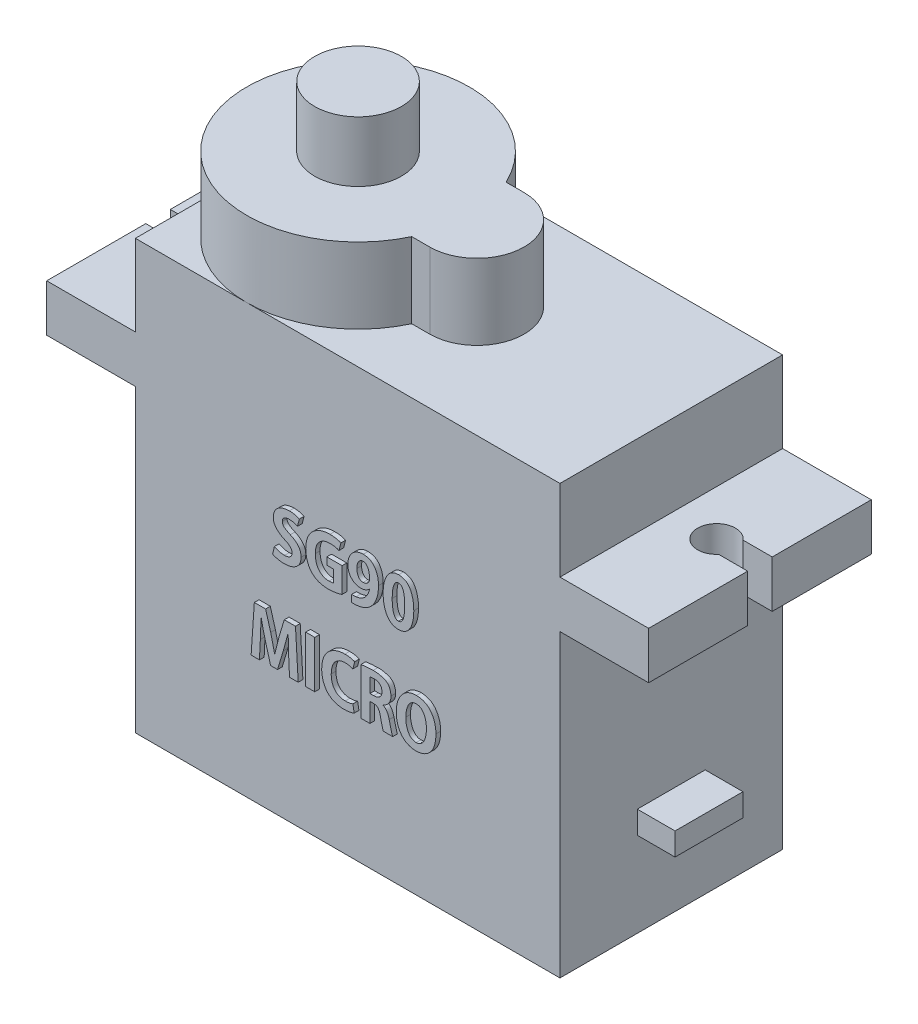
from build123d import *

# Parameters (mm, degrees)
BOSS_EXTRUDE1_DEPTH = 5.9
BOSS_EXTRUDE2_DEPTH = 4
SKETCH3_R           = 2.3
BOSS_EXTRUDE3_DEPTH = 3.2
CUT_EXTRUDE1_DEPTH  = 26.055388642
SKETCH5_W           = 3.6
SKETCH5_H           = 1.2
BOSS_EXTRUDE4_DEPTH = 2
WRAP1_OUTLINE_W     = 0.47888441
WRAP1_OUTLINE_H     = 2.5
WRAP1_DEPTH         = 0.25


# Read off the part's stored shape, not the designer's step: Wrap1
with BuildPart() as part:
    # Sketch1 → Boss-Extrude1 (new, symmetric)
    with BuildSketch(Plane.XY):
        Polygon((-11.25, -15.9), (-11.25, 0), (-15.95, 0), (-15.95, 2.5), (-11.25, 2.5), (-11.25, 6.8), (11.25, 6.8), (11.25, 2.5), (15.95, 2.5), (15.95, 0), (11.25, 0), (11.25, -15.9), align=None)
    extrude(amount=BOSS_EXTRUDE1_DEPTH, both=True)

    # Sketch2 → Boss-Extrude2 (add)
    with BuildSketch(Plane(origin=(0, 6.8, 0), x_dir=(1, 0, 0), z_dir=(0, 1, 0))):
        with BuildLine():
            Line((-0.005844314, 2.5), (0.95, 2.5))
            ThreePointArc((0.95, 2.5), (3.45, 0), (0.95, -2.5))
            Line((0.95, -2.5), (-0.005844314, -2.5))
            ThreePointArc((-0.005844314, -2.5), (-11.25, 0), (-0.005844314, 2.5))
        make_face()
    extrude(amount=BOSS_EXTRUDE2_DEPTH)

    # Sketch3 → Boss-Extrude3 (add)
    with BuildSketch(Plane(origin=(0, 10.8, 0), x_dir=(1, 0, 0), z_dir=(0, 1, 0))):
        with Locations(Location((-5.35, 0, 0), (0, 0, 270))):
            Circle(SKETCH3_R)
    extrude(amount=BOSS_EXTRUDE3_DEPTH)

    # Sketch4 → Cut-Extrude1 (cut, symmetric)
    with BuildSketch(Plane(origin=(0, 2.5, 0), x_dir=(1, 0, 0), z_dir=(0, 1, 0))):
        with BuildLine():
            Line((14.409934208, 0.65), (15.95, 0.65))
            Line((15.95, 0.65), (15.95, -0.65))
            Line((15.95, -0.65), (14.409934208, -0.65))
            ThreePointArc((14.409934208, -0.65), (12.65, 0), (14.409934208, 0.65))
        make_face()
    cut_extrude1 = extrude(amount=CUT_EXTRUDE1_DEPTH, both=True, mode=Mode.SUBTRACT)

    # Mirror1: Cut-Extrude1 across plane
    add(cut_extrude1.mirror(Plane(origin=(0, 0, 0), x_dir=(0, 0, 1), z_dir=(1, 0, 0))), mode=Mode.SUBTRACT)

    # Sketch5 → Boss-Extrude4 (add)
    with BuildSketch(Plane(origin=(11.25, 0, 0), x_dir=(0, 0, -1), z_dir=(1, 0, 0))):
        with Locations((0, -10.8)):
            Rectangle(SKETCH5_W, SKETCH5_H)
    extrude(amount=BOSS_EXTRUDE4_DEPTH)

    # Wrap1 outline → Wrap1 (add)
    # profile 1 of 9: a face of its own
    with BuildSketch(Plane.XY.offset(5.9)):
        with BuildLine():
            add(Edge.make_bspline(
                [(-3.726019761, -3.8052491), (-3.709521827, -3.814377835), (-3.674316811, -3.833857685), (-3.61426598, -3.856927943), (-3.54587038, -3.879911353), (-3.468881391, -3.899388091), (-3.386271723, -3.916903141), (-3.299531612, -3.92951219), (-3.209995099, -3.937702129), (-3.149213892, -3.939186137), (-3.118401781, -3.939938433)],
                knots=[0, 0, 0, 0, 0.089949334, 0.191943291, 0.306549137, 0.434490538, 0.570906174, 0.709705073, 0.85283939, 1, 1, 1, 1], degree=3))
            add(Edge.make_bspline(
                [(-3.118401781, -3.939938433), (-3.083331252, -3.939056892), (-3.015064198, -3.937340917), (-2.9160755, -3.926011514), (-2.823098072, -3.910108536), (-2.736688138, -3.886682939), (-2.656045159, -3.858410103), (-2.582077756, -3.822730493), (-2.514242094, -3.781148453), (-2.452806043, -3.733642075), (-2.398773665, -3.680429819), (-2.350420754, -3.624116348), (-2.311001541, -3.562473888), (-2.277346792, -3.497737271), (-2.252223693, -3.428191465), (-2.232923108, -3.354941283), (-2.222386949, -3.277216948), (-2.220509062, -3.224154578), (-2.219551691, -3.1971027)],
                knots=[0, 0, 0, 0, 0.08005175, 0.155825911, 0.227240158, 0.295191695, 0.359974716, 0.422060291, 0.482286178, 0.541334182, 0.598912813, 0.655171416, 0.710386691, 0.765569336, 0.821404422, 0.878821951, 0.938221873, 1, 1, 1, 1], degree=3))
            add(Edge.make_bspline(
                [(-2.219551691, -3.1971027), (-2.2198883, -3.17682292), (-2.220552682, -3.136795695), (-2.226582591, -3.077777844), (-2.237815899, -3.021035733), (-2.251946905, -2.96587868), (-2.272178416, -2.913339106), (-2.295619867, -2.862333731), (-2.324201416, -2.813799655), (-2.356759058, -2.766817933), (-2.394368351, -2.721939278), (-2.436491879, -2.678369519), (-2.483626257, -2.636487208), (-2.535940273, -2.596525258), (-2.592396871, -2.557142146), (-2.654269222, -2.520119661), (-2.720989153, -2.484768454), (-2.767477178, -2.462728575), (-2.791290107, -2.451438913)],
                knots=[0, 0, 0, 0, 0.060725293, 0.119856575, 0.177345818, 0.233840644, 0.2901215, 0.345691803, 0.401777612, 0.458555828, 0.516690316, 0.576917763, 0.639904969, 0.705312986, 0.773964301, 0.845941959, 0.92108563, 1, 1, 1, 1], degree=3))
            add(Edge.make_bspline(
                [(-2.791290107, -2.451438913), (-2.809391954, -2.443184403), (-2.844500743, -2.427174666), (-2.894851055, -2.402776272), (-2.941189, -2.378671089), (-2.983623622, -2.355097419), (-3.02251629, -2.332169992), (-3.057139005, -2.308942111), (-3.08844803, -2.287063875), (-3.115741061, -2.265081354), (-3.139746976, -2.242885793), (-3.160173626, -2.219188405), (-3.17733844, -2.193849556), (-3.191414929, -2.167353611), (-3.201992248, -2.139269725), (-3.209356707, -2.110017063), (-3.214505068, -2.079258393), (-3.214538596, -2.058203869), (-3.214555645, -2.047498416)],
                knots=[0, 0, 0, 0, 0.095893322, 0.185986453, 0.269650008, 0.34761872, 0.419959612, 0.487171771, 0.548531692, 0.604000941, 0.655968434, 0.705909997, 0.754430356, 0.803210058, 0.850187023, 0.898677824, 0.948481394, 1, 1, 1, 1], degree=3))
            add(Edge.make_bspline(
                [(-3.214555645, -2.047498416), (-3.21362287, -2.029620264), (-3.211775517, -1.994212718), (-3.194848543, -1.942945484), (-3.166832531, -1.895492966), (-3.134686379, -1.860173456), (-3.103861531, -1.834556515), (-3.076778561, -1.817782034), (-3.046928401, -1.802850028), (-3.013640763, -1.791529479), (-2.977728374, -1.781286571), (-2.93855871, -1.774430257), (-2.896319195, -1.770359672), (-2.867184619, -1.769110651), (-2.852093285, -1.768463674)],
                knots=[0, 0, 0, 0, 0.104400616, 0.20676463, 0.312273029, 0.424913538, 0.484372413, 0.546365541, 0.610930973, 0.679281638, 0.751786484, 0.829345722, 0.911603293, 1, 1, 1, 1], degree=3))
            add(Edge.make_bspline(
                [(-2.852093285, -1.768463674), (-2.827567426, -1.76927556), (-2.780146479, -1.770845349), (-2.711605908, -1.777807847), (-2.64827358, -1.789040444), (-2.590251912, -1.804147773), (-2.537915046, -1.821917946), (-2.490697259, -1.838979729), (-2.449251904, -1.856867916), (-2.424197246, -1.870123118), (-2.412330761, -1.8764011)],
                knots=[0, 0, 0, 0, 0.160970687, 0.311238126, 0.451566846, 0.582579129, 0.704168556, 0.814080921, 0.911944276, 1, 1, 1, 1], degree=3))
            Line((-2.412330761, -1.8764011), (-2.312280497, -1.490122137))
            add(Edge.make_bspline(
                [(-2.312280497, -1.490122137), (-2.327820027, -1.483011715), (-2.360232449, -1.468180767), (-2.412335172, -1.447404079), (-2.47084954, -1.430429986), (-2.534369285, -1.412818942), (-2.603827242, -1.3990034), (-2.678649587, -1.387860484), (-2.758999522, -1.382206325), (-2.814222346, -1.380801219), (-2.842666436, -1.380077479)],
                knots=[0, 0, 0, 0, 0.093885412, 0.195826607, 0.307768122, 0.428363098, 0.557859077, 0.696525779, 0.843686948, 1, 1, 1, 1], degree=3))
            add(Edge.make_bspline(
                [(-2.842666436, -1.380077479), (-2.87537269, -1.381222601), (-2.939056057, -1.383452303), (-3.031562332, -1.393778657), (-3.118435785, -1.410190214), (-3.199613507, -1.432821817), (-3.275515029, -1.460953831), (-3.345674444, -1.49548332), (-3.410243625, -1.536130905), (-3.468566327, -1.582948719), (-3.521012043, -1.634137302), (-3.566372628, -1.689674146), (-3.605501482, -1.748346349), (-3.63726621, -1.811006766), (-3.661717401, -1.87736671), (-3.67961997, -1.947159516), (-3.69132146, -2.020560717), (-3.693036346, -2.070863611), (-3.693910937, -2.096518033)],
                knots=[0, 0, 0, 0, 0.078559742, 0.152966122, 0.223255178, 0.290622459, 0.355087877, 0.417344151, 0.478048272, 0.537908362, 0.596597943, 0.653693265, 0.709776301, 0.765621559, 0.821962845, 0.87924233, 0.938413718, 1, 1, 1, 1], degree=3))
            add(Edge.make_bspline(
                [(-3.693910937, -2.096518033), (-3.693160587, -2.116656199), (-3.691677632, -2.156456319), (-3.683391889, -2.21509946), (-3.670900089, -2.271822953), (-3.652853968, -2.326455291), (-3.629434769, -2.378723016), (-3.602299043, -2.429538439), (-3.569391865, -2.477852176), (-3.531527015, -2.523905439), (-3.489650537, -2.568024051), (-3.443944149, -2.610310995), (-3.394533337, -2.65078723), (-3.340968489, -2.689322177), (-3.284083568, -2.726921303), (-3.222521857, -2.761242659), (-3.157925611, -2.795272798), (-3.112711593, -2.815412466), (-3.08964989, -2.825684834)],
                knots=[0, 0, 0, 0, 0.060045621, 0.11867133, 0.176285329, 0.233016685, 0.289850435, 0.346859566, 0.404542072, 0.463798733, 0.524433407, 0.585751735, 0.649325732, 0.714723398, 0.782410973, 0.852478072, 0.924755486, 1, 1, 1, 1], degree=3))
            add(Edge.make_bspline(
                [(-3.08964989, -2.825684834), (-3.057683929, -2.840147391), (-2.997510603, -2.86737198), (-2.915835953, -2.91284835), (-2.847317346, -2.958444342), (-2.792281649, -3.006228843), (-2.74875856, -3.056446008), (-2.719375649, -3.112270136), (-2.700709895, -3.172660131), (-2.699205161, -3.214716502), (-2.69843564, -3.236224125)],
                knots=[0, 0, 0, 0, 0.174208187, 0.327932775, 0.463869018, 0.582215029, 0.689132344, 0.791780352, 0.893516498, 1, 1, 1, 1], degree=3))
            add(Edge.make_bspline(
                [(-2.69843564, -3.236224125), (-2.698657246, -3.247867885), (-2.699090433, -3.270628705), (-2.703938097, -3.303812778), (-2.711845731, -3.33516713), (-2.723455067, -3.364572273), (-2.73744128, -3.39259303), (-2.755078487, -3.418677981), (-2.77598356, -3.442854611), (-2.800037578, -3.464967786), (-2.827088396, -3.484833622), (-2.857071922, -3.50241196), (-2.890064701, -3.517439154), (-2.92607307, -3.529694159), (-2.965085788, -3.538980429), (-3.00695378, -3.546084058), (-3.052020564, -3.550220199), (-3.083043011, -3.551098364), (-3.09907674, -3.551552238)],
                knots=[0, 0, 0, 0, 0.060610406, 0.118479126, 0.174255688, 0.228664596, 0.282832933, 0.337081579, 0.392205902, 0.448964468, 0.506908369, 0.566701069, 0.629690314, 0.695426735, 0.764501725, 0.838365429, 0.916460334, 1, 1, 1, 1], degree=3))
            add(Edge.make_bspline(
                [(-3.09907674, -3.551552238), (-3.124230445, -3.550739283), (-3.174170355, -3.54912525), (-3.248394131, -3.541657639), (-3.321108807, -3.528794524), (-3.391766463, -3.511487155), (-3.459012333, -3.490338973), (-3.521953962, -3.466948511), (-3.579691156, -3.440742422), (-3.615333246, -3.420464947), (-3.632636415, -3.410620839)],
                knots=[0, 0, 0, 0, 0.135306303, 0.268635751, 0.400728151, 0.532075447, 0.659536786, 0.779580719, 0.89299303, 1, 1, 1, 1], degree=3))
            Line((-3.632636415, -3.410620839), (-3.726019761, -3.8052491))
        make_face()
    # profile 2 of 9: a face of its own
    with BuildSketch(Plane.XY.offset(5.9)):
        with BuildLine():
            Line((-0.495853199, -2.881303706), (-0.495853199, -3.514504443))
            add(Edge.make_bspline(
                [(-0.495853199, -3.514504443), (-0.502068146, -3.517454058), (-0.515257719, -3.523713831), (-0.537992221, -3.52978029), (-0.563701639, -3.536057868), (-0.59300964, -3.541043165), (-0.625684203, -3.545471208), (-0.661909103, -3.547850925), (-0.701641105, -3.550474599), (-0.72931898, -3.551182445), (-0.743778417, -3.551552238)],
                knots=[0, 0, 0, 0, 0.081644328, 0.1732684, 0.278857601, 0.396502646, 0.526508958, 0.670805947, 0.828022889, 1, 1, 1, 1], degree=3))
            add(Edge.make_bspline(
                [(-0.743778417, -3.551552238), (-0.769589485, -3.551030636), (-0.820350952, -3.550004825), (-0.894342649, -3.538614929), (-0.964997253, -3.521518222), (-1.031620999, -3.496046276), (-1.095151888, -3.464733116), (-1.154521232, -3.425437905), (-1.210368612, -3.379558808), (-1.262309316, -3.326579227), (-1.3096456, -3.266872873), (-1.350229111, -3.199507234), (-1.385299687, -3.125670252), (-1.413654877, -3.044649049), (-1.437017694, -2.957270549), (-1.452947661, -2.862881907), (-1.464132469, -2.761837598), (-1.466215051, -2.692012638), (-1.467289109, -2.656001545)],
                knots=[0, 0, 0, 0, 0.059604782, 0.117222045, 0.172616742, 0.227313207, 0.281713572, 0.335997474, 0.391463532, 0.448466519, 0.507161829, 0.567132694, 0.629828367, 0.695753162, 0.765245473, 0.838614105, 0.916767838, 1, 1, 1, 1], degree=3))
            add(Edge.make_bspline(
                [(-1.467289109, -2.656001545), (-1.466075829, -2.620302755), (-1.463722929, -2.551072456), (-1.451858383, -2.451006615), (-1.433693555, -2.358095758), (-1.408852088, -2.272709764), (-1.377730472, -2.19430123), (-1.339452936, -2.123557788), (-1.295134787, -2.059412815), (-1.243099197, -2.003836852), (-1.186460324, -1.954872441), (-1.125997918, -1.912063861), (-1.06116952, -1.876576188), (-0.992825463, -1.84735505), (-0.920539653, -1.824512476), (-0.844429774, -1.808705174), (-0.76445639, -1.799016926), (-0.709869857, -1.798136099), (-0.682032554, -1.797686907)],
                knots=[0, 0, 0, 0, 0.081158924, 0.157390671, 0.228756257, 0.296107102, 0.359237718, 0.42011516, 0.478567741, 0.53593354, 0.592640872, 0.648519059, 0.703981474, 0.760297277, 0.817220091, 0.875982743, 0.936755354, 1, 1, 1, 1], degree=3))
            add(Edge.make_bspline(
                [(-0.682032554, -1.797686907), (-0.65578944, -1.798111021), (-0.605302074, -1.798926944), (-0.532739928, -1.803365492), (-0.466576704, -1.811607745), (-0.406186684, -1.821573658), (-0.351212222, -1.835383171), (-0.3001458, -1.849472688), (-0.25336132, -1.866596319), (-0.223981664, -1.879551327), (-0.209747399, -1.885827949)],
                knots=[0, 0, 0, 0, 0.162603636, 0.312822215, 0.450098562, 0.575560869, 0.691717561, 0.801089253, 0.903628951, 1, 1, 1, 1], degree=3))
            Line((-0.209747399, -1.885827949), (-0.110784353, -1.486298003))
            add(Edge.make_bspline(
                [(-0.110784353, -1.486298003), (-0.127039126, -1.478988767), (-0.161292291, -1.463586247), (-0.217128087, -1.443079974), (-0.280740274, -1.426302105), (-0.350901395, -1.410126043), (-0.427507966, -1.397017689), (-0.509649606, -1.387733944), (-0.597114829, -1.382130359), (-0.657200229, -1.381086621), (-0.688160006, -1.380548821)],
                knots=[0, 0, 0, 0, 0.090390589, 0.190477202, 0.301261597, 0.423833096, 0.555634891, 0.695213287, 0.842954714, 1, 1, 1, 1], degree=3))
            add(Edge.make_bspline(
                [(-0.688160006, -1.380548821), (-0.733300555, -1.38166018), (-0.821829572, -1.383839762), (-0.9514777, -1.400215185), (-1.074961559, -1.426538041), (-1.192593924, -1.462896019), (-1.304216778, -1.509460488), (-1.409422251, -1.567103736), (-1.508893246, -1.634209771), (-1.586240216, -1.698417801), (-1.643989765, -1.754886961), (-1.684877385, -1.799592462), (-1.723441356, -1.846403759), (-1.758553525, -1.895897068), (-1.791217562, -1.947538403), (-1.821458011, -2.001249455), (-1.848844099, -2.057439055), (-1.873192823, -2.116103244), (-1.895649499, -2.176785377), (-1.914135195, -2.240091636), (-1.930701172, -2.305320488), (-1.945100392, -2.372692393), (-1.955566099, -2.442635041), (-1.964202523, -2.514760026), (-1.969909052, -2.58930285), (-1.971360609, -2.639809482), (-1.972096894, -2.665428394)],
                knots=[0, 0, 0, 0, 0.066177184, 0.129785772, 0.191283754, 0.251108841, 0.310068885, 0.368317079, 0.426719516, 0.485773106, 0.515423448, 0.545100629, 0.574569622, 0.604296836, 0.634016908, 0.664136115, 0.694634449, 0.725611945, 0.757242206, 0.789459355, 0.822258555, 0.855920241, 0.890425936, 0.925917359, 0.962422427, 1, 1, 1, 1], degree=3))
            add(Edge.make_bspline(
                [(-1.972096894, -2.665428394), (-1.970809702, -2.715433139), (-1.96828891, -2.8133607), (-1.951790232, -2.956758887), (-1.923804798, -3.093065986), (-1.891968094, -3.201709352), (-1.861218632, -3.284325164), (-1.835543188, -3.343082143), (-1.807847456, -3.399159536), (-1.777715438, -3.452564686), (-1.744901327, -3.502955667), (-1.710862307, -3.551340665), (-1.673304682, -3.596234648), (-1.646553211, -3.624281286), (-1.633201658, -3.638279252)],
                knots=[0, 0, 0, 0, 0.142070221, 0.278225407, 0.409455379, 0.536998446, 0.599432275, 0.659805439, 0.71909623, 0.777066659, 0.833900218, 0.889891332, 0.945045199, 1, 1, 1, 1], degree=3))
            add(Edge.make_bspline(
                [(-1.633201658, -3.638279252), (-1.606271863, -3.662857126), (-1.552338194, -3.712080483), (-1.460704453, -3.773701327), (-1.361545703, -3.825818469), (-1.254494831, -3.868152924), (-1.139588685, -3.901242221), (-1.016848138, -3.924499029), (-0.886137219, -3.938449127), (-0.796447337, -3.939433037), (-0.750377212, -3.939938433)],
                knots=[0, 0, 0, 0, 0.114129581, 0.228573108, 0.344861668, 0.464636797, 0.588675599, 0.719038151, 0.855681074, 1, 1, 1, 1], degree=3))
            add(Edge.make_bspline(
                [(-0.750377212, -3.939938433), (-0.714853035, -3.939199383), (-0.644974617, -3.937745622), (-0.542131476, -3.929420343), (-0.442872741, -3.917315868), (-0.348247362, -3.900917594), (-0.260145402, -3.881710252), (-0.180616183, -3.861536543), (-0.110496419, -3.841167158), (-0.067647352, -3.825609055), (-0.047605589, -3.818332076)],
                knots=[0, 0, 0, 0, 0.14873289, 0.292567484, 0.431759076, 0.567261587, 0.694476425, 0.809185708, 0.910750569, 1, 1, 1, 1], degree=3))
            Line((-0.047605589, -3.818332076), (-0.047134707, -2.49857362))
            Line((-0.047134707, -2.49857362), (-0.857590133, -2.49857362))
            Line((-0.857590133, -2.49857362), (-0.857590133, -2.881303706))
            Line((-0.857590133, -2.881303706), (-0.495853199, -2.881303706))
        make_face()
    # profile 3 of 9: a face of its own
    with BuildSketch(Plane.XY.offset(5.9)):
        with BuildLine():
            add(Edge.make_bspline(
                [(0.460291238, -3.939594592), (0.490372136, -3.940177953), (0.549697682, -3.941328458), (0.637355817, -3.937653982), (0.722110345, -3.931190999), (0.803797227, -3.921495187), (0.882249349, -3.907671964), (0.957614584, -3.890789324), (1.030118428, -3.870679499), (1.099256107, -3.846241541), (1.166066979, -3.820103038), (1.228723827, -3.788111746), (1.289336174, -3.754907551), (1.345961585, -3.71644485), (1.400411553, -3.675968489), (1.450817874, -3.630674501), (1.498591418, -3.582586146), (1.558098534, -3.514082937), (1.625118336, -3.422054605), (1.695293341, -3.304217669), (1.754189974, -3.178788619), (1.802549786, -3.046342767), (1.838954163, -2.906569559), (1.865542159, -2.759927179), (1.880585733, -2.60573032), (1.882192364, -2.500490773), (1.883013167, -2.446725488)],
                knots=[0, 0, 0, 0, 0.038244534, 0.075425869, 0.111490945, 0.146302794, 0.179964872, 0.212725223, 0.244472331, 0.27555384, 0.305934172, 0.335593393, 0.364929984, 0.393739526, 0.422544913, 0.451127797, 0.479801977, 0.508684835, 0.566418076, 0.624280766, 0.68281027, 0.742338225, 0.803291989, 0.866219321, 0.931653485, 1, 1, 1, 1], degree=3))
            add(Edge.make_bspline(
                [(1.883013167, -2.446725488), (1.882374709, -2.409468548), (1.881125314, -2.336560595), (1.871519443, -2.229980456), (1.85621979, -2.128658656), (1.834162411, -2.032631404), (1.805252605, -1.942145363), (1.771104541, -1.856711615), (1.72976494, -1.777089905), (1.682449099, -1.703146157), (1.629018997, -1.636010822), (1.568863984, -1.577264962), (1.502663321, -1.526974324), (1.429891108, -1.485677989), (1.350774174, -1.453478078), (1.265623778, -1.430211188), (1.174331524, -1.414746771), (1.111331616, -1.411773741), (1.078902914, -1.410243397)],
                knots=[0, 0, 0, 0, 0.0755691, 0.147880864, 0.216892689, 0.28330391, 0.347511938, 0.409419572, 0.469717947, 0.529216711, 0.587254895, 0.643375511, 0.699342968, 0.755439142, 0.812613274, 0.872154705, 0.934192649, 1, 1, 1, 1], degree=3))
            add(Edge.make_bspline(
                [(1.078902914, -1.410243397), (1.048050188, -1.411663), (0.987605485, -1.414444196), (0.899767262, -1.429071141), (0.816900657, -1.450148116), (0.738869124, -1.478231942), (0.666465793, -1.515062326), (0.598556569, -1.558415731), (0.535972119, -1.609724729), (0.479326319, -1.668090812), (0.428600888, -1.731825974), (0.383592835, -1.799119757), (0.34568358, -1.870384225), (0.314559043, -1.945060893), (0.289940372, -2.023300865), (0.272018243, -2.104983572), (0.26117006, -2.190349848), (0.258953169, -2.248417098), (0.257824331, -2.277984884)],
                knots=[0, 0, 0, 0, 0.069387197, 0.135938996, 0.199767061, 0.26145376, 0.321957935, 0.382022269, 0.442268103, 0.503468429, 0.564538128, 0.625182378, 0.685233208, 0.745718819, 0.806829369, 0.86939677, 0.933496967, 1, 1, 1, 1], degree=3))
            add(Edge.make_bspline(
                [(0.257824331, -2.277984884), (0.258961652, -2.306611113), (0.261180928, -2.362470028), (0.271694817, -2.443798862), (0.287647098, -2.520416467), (0.308986854, -2.592438118), (0.337361549, -2.65919962), (0.369936518, -2.721912387), (0.40957165, -2.779173345), (0.454168193, -2.831587505), (0.503853434, -2.87784413), (0.556042997, -2.919458696), (0.612325068, -2.9538272), (0.671289778, -2.98297904), (0.733881556, -3.005019448), (0.799429758, -3.020907154), (0.868014196, -3.031812508), (0.914990038, -3.033273925), (0.9389142, -3.034018206)],
                knots=[0, 0, 0, 0, 0.075338445, 0.147009363, 0.21542667, 0.281065864, 0.34424093, 0.40599658, 0.466644053, 0.527031817, 0.586679507, 0.64497139, 0.702322245, 0.759811448, 0.81772551, 0.876469898, 0.937087786, 1, 1, 1, 1], degree=3))
            add(Edge.make_bspline(
                [(0.9389142, -3.034018206), (0.963772393, -3.033230289), (1.01211862, -3.031697884), (1.082079136, -3.021698864), (1.147202656, -3.005756399), (1.207663567, -2.983539574), (1.263000131, -2.955127939), (1.314164418, -2.922354179), (1.360571617, -2.884745515), (1.387773179, -2.856004212), (1.401301163, -2.841710478)],
                knots=[0, 0, 0, 0, 0.144395029, 0.280831146, 0.409667473, 0.53326653, 0.654091248, 0.770297817, 0.885763636, 1, 1, 1, 1], degree=3))
            Line((1.401301163, -2.841710478), (1.410977953, -2.844870406))
            add(Edge.make_bspline(
                [(1.410977953, -2.844870406), (1.406192958, -2.868248238), (1.396749709, -2.914384685), (1.377104085, -2.981421618), (1.354219754, -3.045601568), (1.327039703, -3.106754207), (1.296636234, -3.165192815), (1.261882781, -3.220756976), (1.223373086, -3.273448057), (1.180909173, -3.3230051), (1.134793589, -3.36902349), (1.084254243, -3.410063206), (1.029595032, -3.446153986), (0.970954567, -3.477177017), (0.908586617, -3.50376355), (0.842085053, -3.524832053), (0.771663759, -3.541555061), (0.72295183, -3.548483094), (0.698058198, -3.55202358)],
                knots=[0, 0, 0, 0, 0.06607286, 0.130395621, 0.193307205, 0.25468426, 0.315613782, 0.375630338, 0.436040079, 0.496225233, 0.5562339, 0.616250456, 0.676240183, 0.737372972, 0.799775216, 0.863773261, 0.930382999, 1, 1, 1, 1], degree=3))
            add(Edge.make_bspline(
                [(0.698058198, -3.55202358), (0.68108487, -3.553376514), (0.649960385, -3.555857429), (0.607601015, -3.560079459), (0.573453362, -3.562057411), (0.539276576, -3.565006995), (0.502227179, -3.565426338), (0.474001736, -3.563082141), (0.460030251, -3.561921772)],
                knots=[0, 0, 0, 0, 0.214070516, 0.392547345, 0.535110574, 0.64403833, 0.823800357, 1, 1, 1, 1], degree=3))
            Line((0.460030251, -3.561921772), (0.460291238, -3.939594592))
        make_face()
        with BuildLine():
            add(Edge.make_bspline(
                [(1.062754831, -1.737827334), (1.0766782, -1.738840937), (1.104000503, -1.740829966), (1.143329346, -1.750579476), (1.179987464, -1.764723972), (1.214147457, -1.783841797), (1.245186976, -1.808459696), (1.273312526, -1.83832337), (1.298893062, -1.872915821), (1.321133054, -1.912547152), (1.340811047, -1.955823338), (1.357648294, -2.002245465), (1.372359268, -2.051293481), (1.384102319, -2.103271314), (1.392813018, -2.157932715), (1.399600821, -2.215309537), (1.403204855, -2.275424609), (1.403817359, -2.316473692), (1.404129218, -2.337374035)],
                knots=[0, 0, 0, 0, 0.054666474, 0.107273888, 0.158194256, 0.208408822, 0.260183252, 0.312920419, 0.368871477, 0.428485839, 0.490803097, 0.555134974, 0.622004819, 0.691513952, 0.76394418, 0.839000286, 0.918026199, 1, 1, 1, 1], degree=3))
            add(Edge.make_bspline(
                [(1.404129218, -2.337374035), (1.404203762, -2.348687204), (1.404344599, -2.370061432), (1.403415842, -2.400242844), (1.401646414, -2.426843917), (1.397951366, -2.456161193), (1.392543394, -2.48757058), (1.382688665, -2.509387087), (1.378205382, -2.519312229)],
                knots=[0, 0, 0, 0, 0.183027137, 0.345797344, 0.488514471, 0.614004943, 0.824396484, 1, 1, 1, 1], degree=3))
            add(Edge.make_bspline(
                [(1.378205382, -2.519312229), (1.371138101, -2.531617755), (1.356827697, -2.556534982), (1.329097975, -2.590585969), (1.296004718, -2.621619956), (1.259357172, -2.650902783), (1.217808418, -2.675782588), (1.171571813, -2.693561709), (1.121560737, -2.705199447), (1.0868236, -2.70726236), (1.069004722, -2.708320559)],
                knots=[0, 0, 0, 0, 0.111908031, 0.226600438, 0.345048618, 0.469626333, 0.596426258, 0.725660414, 0.859273848, 1, 1, 1, 1], degree=3))
            add(Edge.make_bspline(
                [(1.069004722, -2.708320559), (1.056882977, -2.707809756), (1.033112917, -2.706808101), (0.998226286, -2.700613917), (0.965425471, -2.690147092), (0.934086577, -2.67639484), (0.90508884, -2.658418756), (0.877668392, -2.636819504), (0.852302319, -2.611264735), (0.828809757, -2.582020743), (0.807484727, -2.54942491), (0.78924, -2.513473522), (0.773534158, -2.474543452), (0.76102252, -2.432338157), (0.750598995, -2.387185066), (0.74319393, -2.338977678), (0.7383784, -2.287821344), (0.737587013, -2.252700753), (0.737179623, -2.234621377)],
                knots=[0, 0, 0, 0, 0.056253621, 0.110310186, 0.163803388, 0.21569279, 0.268706938, 0.321650863, 0.377325171, 0.43539194, 0.495447469, 0.557723116, 0.622163034, 0.689966848, 0.761768087, 0.837038565, 0.916110721, 1, 1, 1, 1], degree=3))
            add(Edge.make_bspline(
                [(0.737179623, -2.234621377), (0.737635448, -2.216859837), (0.738524148, -2.182231024), (0.742717708, -2.131535243), (0.749750582, -2.083353399), (0.759583637, -2.037497309), (0.772343426, -1.994232866), (0.787355082, -1.953312509), (0.805344543, -1.915256747), (0.825358642, -1.879606588), (0.848586565, -1.847931731), (0.872900785, -1.819069149), (0.899953647, -1.795163875), (0.928509866, -1.774814112), (0.959386459, -1.759262478), (0.992048562, -1.747944407), (1.026601156, -1.740688919), (1.05027373, -1.739107985), (1.062405927, -1.738297756)],
                knots=[0, 0, 0, 0, 0.080989904, 0.157902093, 0.231748049, 0.302836432, 0.371513089, 0.437238992, 0.5013247, 0.563248424, 0.623283308, 0.680154014, 0.734938609, 0.7873982, 0.83961272, 0.891940116, 0.944619296, 1, 1, 1, 1], degree=3))
            Line((1.062405927, -1.738297756), (1.062754831, -1.737827334))
        make_face(mode=Mode.SUBTRACT)
    # profile 4 of 9: a face of its own
    with BuildSketch(Plane.XY.offset(5.9)):
        with BuildLine():
            add(Edge.make_bspline(
                [(2.937925025, -3.937110378), (2.969400592, -3.935804846), (3.031049498, -3.933247795), (3.120706281, -3.916986475), (3.204920183, -3.890615143), (3.28353834, -3.85341046), (3.356509337, -3.805889362), (3.424062649, -3.748293461), (3.485485558, -3.68025879), (3.54102702, -3.602412566), (3.591185949, -3.515622375), (3.633645323, -3.419270096), (3.670601357, -3.314707527), (3.700445589, -3.201314822), (3.723940176, -3.07926925), (3.740573553, -2.948602579), (3.751103833, -2.809202087), (3.752553518, -2.713367833), (3.753300088, -2.664014367)],
                knots=[0, 0, 0, 0, 0.055713004, 0.109121016, 0.160752875, 0.21151145, 0.26257919, 0.3144651, 0.368213818, 0.424404606, 0.483462557, 0.545333587, 0.610513481, 0.679594244, 0.752683659, 0.830370151, 0.912642705, 1, 1, 1, 1], degree=3))
            add(Edge.make_bspline(
                [(3.753300088, -2.664014367), (3.75314185, -2.621264539), (3.752831468, -2.537411259), (3.744387317, -2.414257668), (3.731269992, -2.296136881), (3.710745656, -2.183359091), (3.684977905, -2.075821299), (3.653546441, -1.973264184), (3.615049522, -1.876297917), (3.572068987, -1.784305977), (3.521608603, -1.70034798), (3.46337637, -1.626109276), (3.396625223, -1.563541831), (3.322886113, -1.510769027), (3.241041786, -1.469699679), (3.151859282, -1.439614574), (3.055467473, -1.419325658), (2.988413346, -1.415196543), (2.953903259, -1.413071452)],
                knots=[0, 0, 0, 0, 0.077012797, 0.151059689, 0.222310448, 0.29105885, 0.357458213, 0.421483072, 0.484149044, 0.545311448, 0.604254358, 0.660273327, 0.714747256, 0.768555766, 0.823124514, 0.879079778, 0.937767179, 1, 1, 1, 1], degree=3))
            add(Edge.make_bspline(
                [(2.953903259, -1.413071452), (2.920506458, -1.414754693), (2.855255012, -1.418043449), (2.761041087, -1.436818022), (2.673267557, -1.465660989), (2.591771894, -1.505040077), (2.516819409, -1.555444013), (2.448448831, -1.616417894), (2.386645563, -1.687848705), (2.332428635, -1.769912398), (2.284258478, -1.860199185), (2.242282214, -1.957670049), (2.206879186, -2.061851981), (2.178344057, -2.173003552), (2.155922077, -2.290937639), (2.139285799, -2.415688216), (2.130073978, -2.547295081), (2.128775594, -2.637291206), (2.128111252, -2.683339408)],
                knots=[0, 0, 0, 0, 0.059052888, 0.115378904, 0.169222366, 0.222018959, 0.274866674, 0.32838172, 0.383515787, 0.441370897, 0.501890388, 0.564221065, 0.628781926, 0.696219058, 0.766927754, 0.840898389, 0.918592682, 1, 1, 1, 1], degree=3))
            add(Edge.make_bspline(
                [(2.128111252, -2.683339408), (2.128440287, -2.72624643), (2.129085792, -2.810421766), (2.137785017, -2.933931311), (2.152102526, -3.052336307), (2.173416645, -3.165292184), (2.200267098, -3.273320365), (2.232891234, -3.376234735), (2.272938344, -3.473481035), (2.317472459, -3.565296448), (2.368636943, -3.649654988), (2.428644124, -3.723287656), (2.495445896, -3.786916882), (2.570136199, -3.83896209), (2.65173583, -3.880662941), (2.740745297, -3.910456412), (2.836770913, -3.930879619), (2.903520867, -3.934993123), (2.937925025, -3.937110378)],
                knots=[0, 0, 0, 0, 0.077028406, 0.151114936, 0.222182084, 0.291067872, 0.357368059, 0.421960324, 0.484720324, 0.546036488, 0.605066539, 0.661418278, 0.716099226, 0.770179415, 0.824304469, 0.880062746, 0.938267313, 1, 1, 1, 1], degree=3))
        make_face()
        with BuildLine():
            add(Edge.make_bspline(
                [(2.941165044, -3.554380292), (2.927742443, -3.55345606), (2.901395172, -3.551641881), (2.863359012, -3.540498151), (2.828432009, -3.522039361), (2.795859192, -3.497087702), (2.766224457, -3.464949746), (2.738782142, -3.426505755), (2.714360983, -3.381084825), (2.692300419, -3.329178782), (2.673253254, -3.27040731), (2.656297134, -3.205084731), (2.64193829, -3.13298095), (2.629634689, -3.054218964), (2.620456888, -2.968633364), (2.613520878, -2.876360152), (2.608630407, -2.77718679), (2.607863192, -2.708798057), (2.607466543, -2.673441216)],
                knots=[0, 0, 0, 0, 0.039424447, 0.077386389, 0.115356741, 0.154852168, 0.197283623, 0.243247784, 0.293214934, 0.348404722, 0.408661432, 0.474461987, 0.546486752, 0.624464592, 0.708481732, 0.799175671, 0.896174215, 1, 1, 1, 1], degree=3))
            add(Edge.make_bspline(
                [(2.607466543, -2.673441216), (2.607941194, -2.638245541), (2.608861165, -2.570028896), (2.612710094, -2.471109494), (2.620611729, -2.378883877), (2.629900872, -2.293228393), (2.643300576, -2.214493364), (2.658690412, -2.142372153), (2.676753747, -2.076908868), (2.698066884, -2.018217725), (2.721296711, -1.966121034), (2.747407387, -1.921096635), (2.774957661, -1.882324254), (2.805281015, -1.851042688), (2.837432224, -1.826040388), (2.872128942, -1.808519059), (2.909093845, -1.797535127), (2.934503525, -1.796382307), (2.947304464, -1.795801537)],
                knots=[0, 0, 0, 0, 0.103508531, 0.200621374, 0.291017648, 0.375662826, 0.453896812, 0.52575955, 0.592459973, 0.653406085, 0.709231932, 0.759948799, 0.806247521, 0.848723035, 0.887625938, 0.925438096, 0.962437056, 1, 1, 1, 1], degree=3))
            add(Edge.make_bspline(
                [(2.947304464, -1.795801537), (2.961056144, -1.796681388), (2.988090419, -1.798411075), (3.026984585, -1.810229322), (3.062945388, -1.828915947), (3.095858107, -1.85495243), (3.125716735, -1.88804079), (3.152577288, -1.928141003), (3.176524134, -1.975204723), (3.197436845, -2.028983931), (3.215617893, -2.089102832), (3.231562709, -2.155214751), (3.245037341, -2.227290308), (3.256368518, -2.305105899), (3.264816688, -2.388772454), (3.270028439, -2.478413061), (3.274196361, -2.573949373), (3.274341508, -2.639656509), (3.274416138, -2.673441216)],
                knots=[0, 0, 0, 0, 0.040515013, 0.079648011, 0.118805675, 0.159392123, 0.202672635, 0.24969552, 0.301281434, 0.358053499, 0.419593518, 0.486329046, 0.558463233, 0.635698469, 0.718110897, 0.806297646, 0.900403857, 1, 1, 1, 1], degree=3))
            add(Edge.make_bspline(
                [(3.274416138, -2.673441216), (3.274112869, -2.708166267), (3.273523985, -2.775594869), (3.269905413, -2.873536163), (3.263292525, -2.965016532), (3.254388126, -3.050069212), (3.243362087, -3.128767862), (3.229288585, -3.201167563), (3.212430509, -3.267114679), (3.193207079, -3.326681478), (3.17184525, -3.379748935), (3.147408567, -3.425885175), (3.12007168, -3.464936726), (3.09008468, -3.497009499), (3.057778891, -3.52271791), (3.022241056, -3.540899731), (2.983962348, -3.552195171), (2.957436119, -3.553645796), (2.944005067, -3.554380292)],
                knots=[0, 0, 0, 0, 0.101950105, 0.197965244, 0.287684371, 0.371174276, 0.448997817, 0.520916039, 0.587594716, 0.648714322, 0.704564219, 0.75533119, 0.801660723, 0.844082537, 0.883850877, 0.922222347, 0.960618762, 1, 1, 1, 1], degree=3))
            Line((2.944005067, -3.554380292), (2.941165044, -3.554380292))
        make_face(mode=Mode.SUBTRACT)
    # profile 5 of 9: a face of its own
    with BuildSketch(Plane.XY.offset(5.9)):
        with BuildLine():
            Line((-3.109663994, -6.512337373), (-3.393347719, -7.449026044))
            add(Edge.make_bspline(
                [(-3.393347719, -7.449026044), (-3.414309717, -7.524480857), (-3.455764137, -7.6737002), (-3.512512111, -7.89641919), (-3.565381487, -8.115151873), (-3.596493905, -8.260319278), (-3.611897347, -8.332190189)],
                knots=[0, 0, 0, 0, 0.258173193, 0.510562983, 0.757684697, 1, 1, 1, 1], degree=3))
            Line((-3.611897347, -8.332190189), (-3.621598993, -8.331936106))
            add(Edge.make_bspline(
                [(-3.621598993, -8.331936106), (-3.636296171, -8.259842184), (-3.665961813, -8.114323614), (-3.716292454, -7.895295578), (-3.770801195, -7.673060462), (-3.810542073, -7.524398845), (-3.830600253, -7.449365742)],
                knots=[0, 0, 0, 0, 0.243313498, 0.491118139, 0.743155056, 1, 1, 1, 1], degree=3))
            Line((-3.830600253, -7.449365742), (-4.100926667, -6.512337373))
            Line((-4.100926667, -6.512337373), (-4.69764071, -6.512337373))
            Line((-4.69764071, -6.512337373), (-4.867082804, -9.012851983))
            Line((-4.867082804, -9.012851983), (-4.426999914, -9.012851983))
            Line((-4.426999914, -9.012851983), (-4.378088927, -8.048492654))
            add(Edge.make_bspline(
                [(-4.378088927, -8.048492654), (-4.373942399, -7.967882321), (-4.365441531, -7.802621707), (-4.355084274, -7.552142532), (-4.345289394, -7.300623959), (-4.341187105, -7.133729395), (-4.339178778, -7.05202404)],
                knots=[0, 0, 0, 0, 0.242813789, 0.497796672, 0.754139981, 1, 1, 1, 1], degree=3))
            Line((-4.339178778, -7.05202404), (-4.32917794, -7.051553618))
            add(Edge.make_bspline(
                [(-4.32917794, -7.051553618), (-4.313871779, -7.129873689), (-4.282940978, -7.288143449), (-4.229809221, -7.523756083), (-4.173568803, -7.755296749), (-4.131556839, -7.906357985), (-4.111049022, -7.980097364)],
                knots=[0, 0, 0, 0, 0.250904372, 0.507029354, 0.759360179, 1, 1, 1, 1], degree=3))
            Line((-4.111049022, -7.980097364), (-3.833546604, -8.977014305))
            Line((-3.833546604, -8.977014305), (-3.468344566, -8.977014305))
            Line((-3.468344566, -8.977014305), (-3.161835713, -7.963785416))
            add(Edge.make_bspline(
                [(-3.161835713, -7.963785416), (-3.140273931, -7.891029523), (-3.096084009, -7.741919526), (-3.032259051, -7.514580505), (-2.971071047, -7.283451639), (-2.933090941, -7.128596834), (-2.914310491, -7.05202404)],
                knots=[0, 0, 0, 0, 0.240928457, 0.493772256, 0.749679884, 1, 1, 1, 1], degree=3))
            Line((-2.914310491, -7.05202404), (-2.904237848, -7.051553618))
            add(Edge.make_bspline(
                [(-2.904237848, -7.051553618), (-2.904610864, -7.086118837), (-2.905385748, -7.157922814), (-2.903408307, -7.269947083), (-2.901335575, -7.390621317), (-2.89596151, -7.562186186), (-2.888743128, -7.779329458), (-2.881875857, -7.953233936), (-2.878488464, -8.039015172)],
                knots=[0, 0, 0, 0, 0.104967352, 0.218053688, 0.340219526, 0.471482844, 0.739300245, 1, 1, 1, 1], degree=3))
            Line((-2.878488464, -8.039015172), (-2.832501733, -9.012851983))
            Line((-2.832501733, -9.012851983), (-2.372738454, -9.012851983))
            Line((-2.372738454, -9.012851983), (-2.516210683, -6.512337373))
            Line((-2.516210683, -6.512337373), (-3.109663994, -6.512337373))
        make_face()
    # profile 6 of 9: a face of its own
    with BuildSketch(Plane.XY.offset(5.9)):
        with BuildLine():
            add(Edge.make_bspline(
                [(0.618967944, -6.572988654), (0.608327274, -6.567840371), (0.584569974, -6.556345862), (0.542902842, -6.541379151), (0.491698123, -6.527432915), (0.431389031, -6.512390317), (0.3616615, -6.500001957), (0.282897678, -6.489888856), (0.194882425, -6.484811326), (0.133237119, -6.483389129), (0.100867289, -6.482642337)],
                knots=[0, 0, 0, 0, 0.066894976, 0.14935563, 0.250162632, 0.367317818, 0.501145338, 0.650871487, 0.816673299, 1, 1, 1, 1], degree=3))
            add(Edge.make_bspline(
                [(0.100867289, -6.482642337), (0.058868485, -6.483431969), (-0.02368378, -6.484984059), (-0.144793516, -6.500658548), (-0.260868812, -6.525309131), (-0.371849787, -6.560908862), (-0.477738458, -6.606774437), (-0.578596405, -6.662675283), (-0.674349814, -6.728529829), (-0.748985108, -6.791594144), (-0.805596499, -6.846647228), (-0.845712946, -6.890939585), (-0.882890611, -6.938121709), (-0.917330386, -6.987821379), (-0.949482515, -7.03986112), (-0.979387368, -7.094399038), (-1.005480092, -7.152156003), (-1.029551941, -7.212065786), (-1.051446615, -7.274409309), (-1.070040633, -7.339653269), (-1.086785537, -7.407163439), (-1.099562007, -7.477628947), (-1.11131793, -7.550293286), (-1.118869008, -7.625862424), (-1.124746874, -7.703813929), (-1.126539617, -7.75667091), (-1.127451188, -7.783547554)],
                knots=[0, 0, 0, 0, 0.062410275, 0.122672768, 0.181224238, 0.238621423, 0.295639021, 0.352516738, 0.409792119, 0.468141963, 0.497543691, 0.527146078, 0.556913884, 0.586785068, 0.616992272, 0.647826057, 0.679181853, 0.711149402, 0.743800871, 0.777362062, 0.811977235, 0.847160695, 0.883797435, 0.921381009, 0.960023927, 1, 1, 1, 1], degree=3))
            add(Edge.make_bspline(
                [(-1.127451188, -7.783547554), (-1.126435463, -7.82946515), (-1.124450864, -7.919182423), (-1.109545341, -8.050320047), (-1.08564331, -8.174523763), (-1.052814832, -8.29200914), (-1.010320858, -8.402393517), (-0.958215915, -8.505825409), (-0.89667996, -8.602212658), (-0.82667754, -8.691670374), (-0.747197787, -8.771879304), (-0.65962028, -8.842998014), (-0.562686319, -8.902383266), (-0.457756235, -8.951453601), (-0.344802473, -8.991030393), (-0.223187306, -9.01868256), (-0.093388935, -9.037014839), (-0.003991514, -9.040328877), (0.04194948, -9.042031948)],
                knots=[0, 0, 0, 0, 0.07094724, 0.138622085, 0.203667424, 0.26623392, 0.32687944, 0.386165866, 0.444898844, 0.503332961, 0.561363155, 0.619037722, 0.677254534, 0.736557363, 0.797756373, 0.861833371, 0.928996696, 1, 1, 1, 1], degree=3))
            add(Edge.make_bspline(
                [(0.04194948, -9.042031948), (0.073378912, -9.041292763), (0.134085311, -9.039865015), (0.221883928, -9.034499484), (0.303207797, -9.02505974), (0.37774786, -9.012461288), (0.444706666, -8.99751613), (0.503119165, -8.98139084), (0.553201861, -8.965740119), (0.582376616, -8.952129556), (0.595776882, -8.945878084)],
                knots=[0, 0, 0, 0, 0.166640801, 0.321869105, 0.466080902, 0.600396416, 0.722436463, 0.829519013, 0.921696327, 1, 1, 1, 1], degree=3))
            Line((0.595776882, -8.945878084), (0.527744764, -8.55325441))
            add(Edge.make_bspline(
                [(0.527744764, -8.55325441), (0.514516381, -8.558641651), (0.487105592, -8.569804657), (0.442896514, -8.583111578), (0.394834475, -8.595520892), (0.324703987, -8.609052912), (0.232805593, -8.62183914), (0.1579505, -8.623869642), (0.12019233, -8.624893862)],
                knots=[0, 0, 0, 0, 0.102903583, 0.213228515, 0.332437899, 0.460591364, 0.727913193, 1, 1, 1, 1], degree=3))
            add(Edge.make_bspline(
                [(0.12019233, -8.624893862), (0.092351028, -8.624124916), (0.037885648, -8.622620643), (-0.04153773, -8.612186848), (-0.116468009, -8.594907028), (-0.186695631, -8.570140557), (-0.252511914, -8.539033252), (-0.313891453, -8.501154005), (-0.370304665, -8.455823967), (-0.422295098, -8.404073242), (-0.468513971, -8.345190775), (-0.509340414, -8.280225521), (-0.543946484, -8.208663572), (-0.571181612, -8.13030456), (-0.594217272, -8.046337749), (-0.609828103, -7.955733308), (-0.619769654, -7.858863305), (-0.621665997, -7.792056865), (-0.622643403, -7.757623718)],
                knots=[0, 0, 0, 0, 0.064531791, 0.12624225, 0.185344972, 0.242479082, 0.298521988, 0.353807072, 0.409265841, 0.46592433, 0.52348867, 0.582402557, 0.643488625, 0.707310408, 0.774456403, 0.845114968, 0.920169684, 1, 1, 1, 1], degree=3))
            add(Edge.make_bspline(
                [(-0.622643403, -7.757623718), (-0.621388611, -7.721144405), (-0.618959696, -7.650530932), (-0.607681886, -7.548260288), (-0.58986056, -7.45323757), (-0.566000214, -7.365339468), (-0.536067924, -7.284580059), (-0.498973927, -7.211543039), (-0.456215907, -7.14531561), (-0.406280392, -7.087342561), (-0.351865174, -7.036463321), (-0.294098214, -6.99168294), (-0.232753677, -6.953990187), (-0.168076542, -6.922923829), (-0.099887638, -6.899342231), (-0.028276863, -6.883027426), (0.046525668, -6.872828213), (0.097534654, -6.871635481), (0.123491727, -6.871028532)],
                knots=[0, 0, 0, 0, 0.083658957, 0.161939714, 0.235621244, 0.305090206, 0.370518786, 0.432697965, 0.492540106, 0.550791444, 0.607616592, 0.663091193, 0.718072469, 0.77236631, 0.827272023, 0.883103303, 0.940514479, 1, 1, 1, 1], degree=3))
            add(Edge.make_bspline(
                [(0.123491727, -6.871028532), (0.144398067, -6.871433801), (0.18500709, -6.872221007), (0.244157933, -6.877061099), (0.299607251, -6.884304017), (0.351265926, -6.894974535), (0.399256635, -6.907053395), (0.44377091, -6.921040564), (0.485368857, -6.935219079), (0.511473497, -6.94658674), (0.524132827, -6.952099437)],
                knots=[0, 0, 0, 0, 0.152326779, 0.29588353, 0.432205674, 0.55950478, 0.680007867, 0.792623495, 0.899433684, 1, 1, 1, 1], degree=3))
            Line((0.524132827, -6.952099437), (0.618967944, -6.572988654))
        make_face()
    # profile 7 of 9: a face of its own
    with BuildSketch(Plane.XY.offset(5.9)):
        with BuildLine():
            Line((1.430995739, -7.986696618), (1.593526958, -7.986696618))
            add(Edge.make_bspline(
                [(1.593526958, -7.986696618), (1.606918471, -7.986803568), (1.633260136, -7.987013941), (1.671587544, -7.990834261), (1.707814646, -7.99720492), (1.741356871, -8.00730791), (1.772748742, -8.019731009), (1.801222775, -8.036268773), (1.827878058, -8.054855527), (1.851799479, -8.077566725), (1.873579319, -8.104050358), (1.894603139, -8.134203859), (1.913116841, -8.169623533), (1.931185832, -8.20896217), (1.946789547, -8.253165746), (1.962233691, -8.301254826), (1.975084709, -8.354291622), (1.982735244, -8.39124269), (1.986708511, -8.410433039)],
                knots=[0, 0, 0, 0, 0.062260084, 0.122468177, 0.178941567, 0.233048569, 0.285159572, 0.335556594, 0.38584754, 0.435994926, 0.488392087, 0.545148459, 0.606620533, 0.673994701, 0.746356234, 0.824477463, 0.908843267, 1, 1, 1, 1], degree=3))
            add(Edge.make_bspline(
                [(1.986708511, -8.410433039), (1.994004104, -8.44705826), (2.007988097, -8.517260484), (2.029498339, -8.617905028), (2.051349919, -8.708927417), (2.071489246, -8.790377064), (2.092101058, -8.860512949), (2.109440763, -8.919399519), (2.125583812, -8.96592791), (2.13724244, -8.992125968), (2.142251526, -9.003381866)],
                knots=[0, 0, 0, 0, 0.182471266, 0.349755946, 0.502814442, 0.639850516, 0.75963995, 0.859935575, 0.939821842, 1, 1, 1, 1], degree=3))
            Line((2.142251526, -9.003381866), (2.635099456, -9.003183478))
            add(Edge.make_bspline(
                [(2.635099456, -9.003183478), (2.628479719, -8.988100748), (2.613328818, -8.953580196), (2.594056568, -8.892953781), (2.572252839, -8.818344462), (2.549946078, -8.730788029), (2.526603481, -8.633838376), (2.501341509, -8.531032249), (2.47607417, -8.423484002), (2.458839119, -8.35025767), (2.450038158, -8.312865147)],
                knots=[0, 0, 0, 0, 0.069026718, 0.157984679, 0.26639736, 0.395027752, 0.536757761, 0.684560391, 0.838922934, 1, 1, 1, 1], degree=3))
            add(Edge.make_bspline(
                [(2.450038158, -8.312865147), (2.442658328, -8.28225306), (2.428393997, -8.223083551), (2.400070286, -8.139706957), (2.367560948, -8.064498734), (2.330596212, -7.99756969), (2.287822003, -7.93897061), (2.238657156, -7.889301727), (2.182109316, -7.849403462), (2.140548557, -7.830366644), (2.119627087, -7.820783609)],
                knots=[0, 0, 0, 0, 0.152878008, 0.295494927, 0.427059482, 0.550393019, 0.666081675, 0.778316158, 0.88840551, 1, 1, 1, 1], degree=3))
            Line((2.119627087, -7.820783609), (2.119998545, -7.810840768))
            add(Edge.make_bspline(
                [(2.119998545, -7.810840768), (2.149091858, -7.798225722), (2.207145226, -7.773053411), (2.28610434, -7.719347274), (2.35859214, -7.655650055), (2.412172427, -7.593732412), (2.449713807, -7.538739291), (2.474682673, -7.494950157), (2.496104707, -7.44896007), (2.513410197, -7.400602679), (2.527707351, -7.350096822), (2.537952656, -7.297120585), (2.544688025, -7.241983493), (2.545998859, -7.204443994), (2.546663365, -7.185413959)],
                knots=[0, 0, 0, 0, 0.117962681, 0.235385052, 0.35404203, 0.476943412, 0.539312144, 0.601993477, 0.664609128, 0.728146227, 0.793219059, 0.860056941, 0.929058159, 1, 1, 1, 1], degree=3))
            add(Edge.make_bspline(
                [(2.546663365, -7.185413959), (2.545327272, -7.165908321), (2.54270161, -7.127576239), (2.534863483, -7.07180407), (2.525574599, -7.018595395), (2.513943741, -6.968345786), (2.499669053, -6.920839332), (2.48327219, -6.876078459), (2.464553168, -6.834082917), (2.44310209, -6.795088239), (2.41952605, -6.758946704), (2.394298679, -6.724987177), (2.36550871, -6.695051285), (2.33545275, -6.666727577), (2.302323199, -6.642042665), (2.26720755, -6.61949154), (2.229525349, -6.600349702), (2.176894514, -6.578780613), (2.110118458, -6.556694492), (2.031494803, -6.53202261), (1.954044967, -6.513523394), (1.878997619, -6.497998831), (1.805587421, -6.487969829), (1.734230346, -6.480747065), (1.664592929, -6.479564088), (1.618896976, -6.481627935), (1.596436946, -6.482642337)],
                knots=[0, 0, 0, 0, 0.04343947, 0.085366356, 0.125093689, 0.163462712, 0.199918661, 0.235270913, 0.26934282, 0.302004188, 0.334062687, 0.365210663, 0.395843533, 0.426238649, 0.45689738, 0.48750835, 0.51889809, 0.550673894, 0.613838687, 0.675145212, 0.733751049, 0.790727029, 0.845393112, 0.898346134, 0.95003608, 1, 1, 1, 1], degree=3))
            add(Edge.make_bspline(
                [(1.596436946, -6.482642337), (1.536401399, -6.483348142), (1.419057685, -6.48472769), (1.274980828, -6.494193339), (1.165715915, -6.504410702), (1.089966697, -6.512835757), (1.019070617, -6.522143174), (0.973620375, -6.52951226), (0.951640447, -6.533075981)],
                knots=[0, 0, 0, 0, 0.278161272, 0.543685844, 0.668719523, 0.78665959, 0.896827681, 1, 1, 1, 1], degree=3))
            Line((0.951640447, -6.533075981), (0.952111329, -9.003183478))
            Line((0.952111329, -9.003183478), (1.430995739, -9.003183478))
            Line((1.430995739, -9.003183478), (1.430995739, -7.986696618))
        make_face()
        with BuildLine():
            add(Edge.make_bspline(
                [(1.430995739, -6.860079486), (1.442887963, -6.857030861), (1.470749663, -6.849888391), (1.51982265, -6.844894292), (1.581440037, -6.840946381), (1.626747916, -6.840892274), (1.651584014, -6.840862614)],
                knots=[0, 0, 0, 0, 0.165669641, 0.388139134, 0.664600575, 1, 1, 1, 1], degree=3))
            add(Edge.make_bspline(
                [(1.651584014, -6.840862614), (1.675049077, -6.840720894), (1.722043015, -6.840437069), (1.791982937, -6.853998067), (1.860573548, -6.877543335), (1.916117683, -6.904927523), (1.957736042, -6.933837989), (1.985499632, -6.961199255), (2.009010102, -6.993662602), (2.029266745, -7.030914555), (2.044110777, -7.073587015), (2.05675975, -7.120593486), (2.064509267, -7.172777354), (2.066658484, -7.209272143), (2.067779415, -7.228306124)],
                knots=[0, 0, 0, 0, 0.108321837, 0.216938248, 0.327480124, 0.443183267, 0.502066368, 0.561164339, 0.622503137, 0.686883408, 0.756547252, 0.83093335, 0.911822717, 1, 1, 1, 1], degree=3))
            add(Edge.make_bspline(
                [(2.067779415, -7.228306124), (2.067246469, -7.243093766), (2.066205079, -7.271989222), (2.060427483, -7.31409582), (2.051551464, -7.354074956), (2.038983061, -7.391791072), (2.02214955, -7.427096121), (2.002043658, -7.460063889), (1.978010868, -7.490444593), (1.95130758, -7.518847524), (1.921059264, -7.544230878), (1.888009246, -7.566614157), (1.851589829, -7.584981126), (1.812635729, -7.600460801), (1.770685778, -7.612851994), (1.726019855, -7.621571039), (1.678441285, -7.62741026), (1.64578861, -7.628424493), (1.628959576, -7.628947223)],
                knots=[0, 0, 0, 0, 0.066209129, 0.129374448, 0.189949061, 0.249335982, 0.306912622, 0.364695108, 0.421818874, 0.480027867, 0.538925449, 0.598229009, 0.658311603, 0.721135305, 0.785675839, 0.853818138, 0.924658558, 1, 1, 1, 1], degree=3))
            Line((1.628959576, -7.628947223), (1.430995739, -7.628476341))
            Line((1.430995739, -7.628476341), (1.430995739, -6.860079486))
        make_face(mode=Mode.SUBTRACT)
    # profile 8 of 9: a face of its own
    with BuildSketch(Plane.XY.offset(5.9)):
        with BuildLine():
            add(Edge.make_bspline(
                [(3.894314339, -6.482171455), (3.853833431, -6.484206557), (3.774682808, -6.488185706), (3.659693806, -6.507384834), (3.551354085, -6.536446649), (3.449623389, -6.576591774), (3.354912471, -6.628432219), (3.266727823, -6.690612717), (3.184858714, -6.763114314), (3.11144271, -6.846878457), (3.044984774, -6.938721787), (2.986862749, -7.037995197), (2.937808727, -7.144176185), (2.897273873, -7.256809737), (2.865082984, -7.376110894), (2.842289726, -7.502249287), (2.827985331, -7.635067349), (2.825535701, -7.725850356), (2.82428408, -7.772235334)],
                knots=[0, 0, 0, 0, 0.064660737, 0.126428428, 0.185690329, 0.243443189, 0.300571807, 0.357632112, 0.415369721, 0.474711182, 0.535065914, 0.596106226, 0.658048334, 0.721519314, 0.786984795, 0.855070169, 0.92594906, 1, 1, 1, 1], degree=3))
            add(Edge.make_bspline(
                [(2.82428408, -7.772235334), (2.825208125, -7.817362249), (2.827018416, -7.905770106), (2.840622995, -8.035047547), (2.861497997, -8.158162461), (2.891190304, -8.275005404), (2.929347415, -8.385538224), (2.975722437, -8.48977621), (3.030047804, -8.587896215), (3.092500118, -8.679117387), (3.1623587, -8.762474), (3.240676221, -8.835245272), (3.326636928, -8.896632276), (3.41925139, -8.948252555), (3.519626964, -8.988262715), (3.627089418, -9.017864401), (3.741805077, -9.037065161), (3.820783884, -9.040661311), (3.861237513, -9.042503291)],
                knots=[0, 0, 0, 0, 0.073462397, 0.143919722, 0.211419498, 0.276627802, 0.339972486, 0.401582131, 0.462158118, 0.522328177, 0.581318619, 0.638881278, 0.695888183, 0.752911156, 0.811102465, 0.871366526, 0.93411282, 1, 1, 1, 1], degree=3))
            add(Edge.make_bspline(
                [(3.861237513, -9.042503291), (3.899942273, -9.04155046), (3.975946593, -9.039679391), (4.086779368, -9.023737314), (4.19202779, -8.998350784), (4.291443279, -8.962585732), (4.385040377, -8.915803164), (4.473156985, -8.859360935), (4.554496203, -8.791349698), (4.630826703, -8.714736549), (4.699326209, -8.627195737), (4.758919668, -8.529150293), (4.809941126, -8.421103605), (4.85155935, -8.302872965), (4.884568533, -8.17481581), (4.908241933, -8.036718832), (4.923330777, -7.888505073), (4.926336999, -7.786254945), (4.927885523, -7.733585252)],
                knots=[0, 0, 0, 0, 0.060825995, 0.119443667, 0.175639604, 0.230804929, 0.285155157, 0.339831654, 0.394926146, 0.451518617, 0.509579885, 0.569228359, 0.631546251, 0.697096065, 0.765994629, 0.839214394, 0.917178309, 1, 1, 1, 1], degree=3))
            add(Edge.make_bspline(
                [(4.927885523, -7.733585252), (4.927274425, -7.69144529), (4.926072314, -7.608550431), (4.913240603, -7.486849064), (4.89373429, -7.369917066), (4.866007679, -7.257756962), (4.82956312, -7.15045645), (4.785194046, -7.048030259), (4.733159919, -6.9502574), (4.673165096, -6.858145756), (4.605428864, -6.773047412), (4.528425064, -6.698270464), (4.442919285, -6.634756055), (4.349201757, -6.581936163), (4.246922971, -6.540538235), (4.136656939, -6.509385715), (4.018065348, -6.489587819), (3.936254671, -6.484999295), (3.894231486, -6.482642337)],
                knots=[0, 0, 0, 0, 0.069299358, 0.136320969, 0.201078078, 0.264203782, 0.326158768, 0.387281676, 0.447640761, 0.508145765, 0.567886873, 0.626195127, 0.684194944, 0.742638806, 0.802683301, 0.865274966, 0.930796626, 1, 1, 1, 1], degree=3))
            Line((3.894231486, -6.482642337), (3.894314339, -6.482171455))
        make_face()
        with BuildLine():
            add(Edge.make_bspline(
                [(3.881254839, -6.87055811), (3.903555254, -6.872584071), (3.947049713, -6.876535482), (4.009942313, -6.890529173), (4.068309998, -6.913062572), (4.122118855, -6.943236683), (4.171528292, -6.981279763), (4.21639837, -7.026768069), (4.256652899, -7.080082805), (4.291589931, -7.140580171), (4.321962015, -7.206246239), (4.349799634, -7.275087512), (4.371972537, -7.347470331), (4.39110108, -7.422590949), (4.405554407, -7.50086279), (4.415881621, -7.582213897), (4.4221317, -7.666555286), (4.422759194, -7.723833449), (4.423077737, -7.752910293)],
                knots=[0, 0, 0, 0, 0.058468233, 0.114035732, 0.167704281, 0.22137126, 0.274656958, 0.330098465, 0.387815374, 0.448714472, 0.512250178, 0.576738828, 0.642563254, 0.709866099, 0.779186749, 0.850367567, 0.92404018, 1, 1, 1, 1], degree=3))
            add(Edge.make_bspline(
                [(4.423077737, -7.752910293), (4.422608859, -7.784345194), (4.421688803, -7.846028268), (4.414959584, -7.936486576), (4.404332094, -8.022739586), (4.389123862, -8.104879671), (4.370018536, -8.18285961), (4.346598633, -8.256878553), (4.317907069, -8.326233829), (4.286521077, -8.391604517), (4.250492151, -8.451152423), (4.209771186, -8.503447571), (4.164908375, -8.548375036), (4.115190245, -8.584780626), (4.062096023, -8.614686303), (4.004277046, -8.635746974), (3.942473087, -8.649810574), (3.899649501, -8.652659272), (3.8777345, -8.654117096)],
                knots=[0, 0, 0, 0, 0.080620875, 0.158198155, 0.232523379, 0.303421254, 0.372325858, 0.43834057, 0.502322841, 0.564680422, 0.624186302, 0.680453411, 0.734309489, 0.786455899, 0.838043439, 0.890066694, 0.94374155, 1, 1, 1, 1], degree=3))
            add(Edge.make_bspline(
                [(3.8777345, -8.654117096), (3.855982379, -8.652645866), (3.813481143, -8.649771247), (3.75185672, -8.635852866), (3.694593431, -8.61395526), (3.640872569, -8.585009912), (3.591822188, -8.547652292), (3.545983016, -8.50353892), (3.504967194, -8.451156798), (3.468720222, -8.391592215), (3.43591113, -8.326980802), (3.407604717, -8.257712775), (3.383752026, -8.184726978), (3.363827015, -8.107922762), (3.348395209, -8.027144419), (3.337115476, -7.942495517), (3.330497383, -7.853883205), (3.329567274, -7.793614016), (3.329091865, -7.762808485)],
                knots=[0, 0, 0, 0, 0.056291889, 0.109988119, 0.162559134, 0.214352635, 0.267147488, 0.321428726, 0.378384711, 0.438566404, 0.50140791, 0.565512244, 0.631779837, 0.699745457, 0.770472327, 0.844219812, 0.92037571, 1, 1, 1, 1], degree=3))
            add(Edge.make_bspline(
                [(3.329091865, -7.762808485), (3.329404786, -7.733574052), (3.330019574, -7.676137827), (3.336324874, -7.591489367), (3.346586645, -7.509812468), (3.361193819, -7.430956648), (3.379941927, -7.355045314), (3.40311898, -7.282156609), (3.430504699, -7.212236433), (3.461731868, -7.145726479), (3.496723437, -7.083775778), (3.538046548, -7.029803807), (3.583666684, -6.983345779), (3.634121003, -6.944772723), (3.68915113, -6.913880834), (3.74897655, -6.890996855), (3.813454312, -6.876331506), (3.858178883, -6.872821966), (3.881033897, -6.871028532)],
                knots=[0, 0, 0, 0, 0.075318027, 0.14797561, 0.218577319, 0.287340901, 0.354501984, 0.419927511, 0.48428084, 0.547846194, 0.609159382, 0.66721576, 0.722465944, 0.776474054, 0.830305866, 0.884513895, 0.940984641, 1, 1, 1, 1], degree=3))
            Line((3.881033897, -6.871028532), (3.881254839, -6.87055811))
        make_face(mode=Mode.SUBTRACT)
    # profile 9 of 9: a face of its own
    with BuildSketch(Plane.XY.offset(5.9)):
        with Locations((-1.734540519, -7.762337373)):
            Rectangle(WRAP1_OUTLINE_W, WRAP1_OUTLINE_H)
    extrude(amount=WRAP1_DEPTH)


solid = part.part
